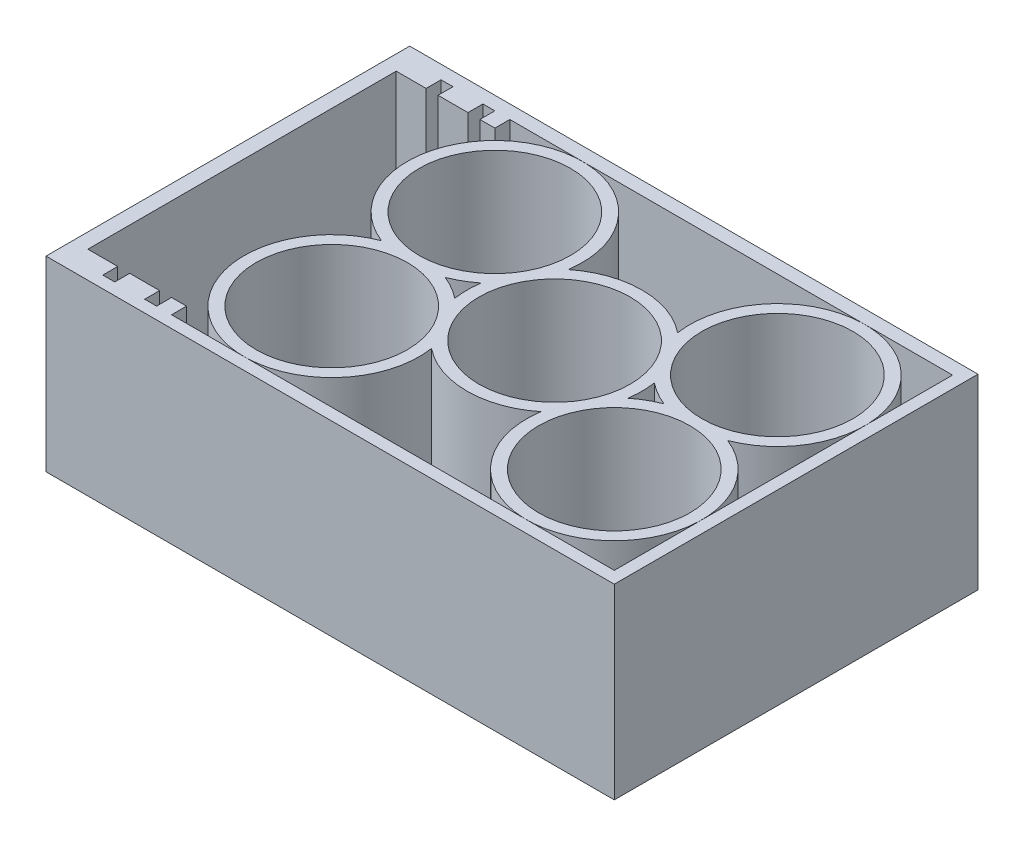
from build123d import *

# Parameters (mm, degrees)
SKETCH1_R             = 10.115000047
BOSS_EXTRUDE4_DEPTH   = 25
SKETCH1_W             = 76.040669035
SKETCH1_H             = 48.666950676
BOSS_EXTRUDE4_2_DEPTH = 25
SKETCH1_9_R           = 10.115000047
CUT_EXTRUDE1_DEPTH    = 36


with BuildPart() as part:
    # Sketch1 → Boss-Extrude4 (new body)
    with BuildSketch(Plane(origin=(0, 0, 0), x_dir=(1, 0, 0), z_dir=(0, 1, 0))):
        with BuildLine():
            ThreePointArc((22.33335059, 40.941406253), (13.444930876, 36.857737704), (10.753243591, 27.45373997))
            ThreePointArc((10.753243591, 27.45373997), (3.42801602, 30.026406253), (-3.897211552, 27.45373997))
            ThreePointArc((-3.897211552, 27.45373997), (-6.588898838, 36.857737705), (-15.477318554, 40.941406253))
            ThreePointArc((-15.477318554, 40.941406253), (-26.990581515, 31.391123299), (-19.732197967, 18.3114063))
            ThreePointArc((-19.732197967, 18.3114063), (-26.990581514, 5.231689296), (-15.477318545, -4.318593653))
            ThreePointArc((-15.477318545, -4.318593653), (-6.588898835, -0.234925102), (-3.897211552, 9.16907263))
            ThreePointArc((-3.897211552, 9.16907263), (3.42801602, 6.596406347), (10.753243591, 9.16907263))
            ThreePointArc((10.753243591, 9.16907263), (13.444930875, -0.234925102), (22.333350586, -4.318593653))
            ThreePointArc((22.333350586, -4.318593653), (30.617106493, -0.887349608), (34.048350537, 7.3964063))
            ThreePointArc((34.048350537, 7.3964063), (32.005142976, 14.006826546), (26.588230006, 18.3114063))
            ThreePointArc((26.588230006, 18.3114063), (32.005142976, 22.615986054), (34.048350537, 29.2264063))
            ThreePointArc((34.048350537, 29.2264063), (30.617106494, 37.510162206), (22.33335059, 40.941406253))
        make_face()
        with Locations((22.333350584, 29.2264063)):
            Circle(SKETCH1_R, mode=Mode.SUBTRACT)
        with BuildLine():
            ThreePointArc((15.008123013, 20.08407263), (16.475850608, 19.080918735), (18.078471162, 18.3114063))
            ThreePointArc((18.078471162, 18.3114063), (16.475850608, 17.541893865), (15.008123013, 16.53873997))
            ThreePointArc((15.008123013, 16.53873997), (15.143015973, 18.3114063), (15.008123013, 20.08407263))
        make_face(mode=Mode.SUBTRACT)
        with Locations((22.333350584, 7.3964063)):
            Circle(SKETCH1_R, mode=Mode.SUBTRACT)
        with BuildLine():
            ThreePointArc((-8.152090974, 16.53873997), (-9.619818569, 17.541893865), (-11.222439123, 18.3114063))
            ThreePointArc((-11.222439123, 18.3114063), (-9.619818569, 19.080918735), (-8.152090974, 20.08407263))
            ThreePointArc((-8.152090974, 20.08407263), (-8.286983933, 18.3114063), (-8.152090974, 16.53873997))
        make_face(mode=Mode.SUBTRACT)
        with Locations((-15.477318545, 7.3964063)):
            Circle(SKETCH1_R, mode=Mode.SUBTRACT)
    extrude(amount=BOSS_EXTRUDE4_DEPTH)

    # Sketch1<9> → Cut-Extrude1 (cut)
    with BuildSketch(Plane(origin=(0, 0, 0), x_dir=(1, 0, 0), z_dir=(0, 1, 0))):
        with Locations((3.42801602, 18.3114063)):
            Circle(SKETCH1_9_R)
        with Locations((-15.477318545, 29.2264063)):
            Circle(SKETCH1_9_R)
    extrude(amount=CUT_EXTRUDE1_DEPTH, mode=Mode.SUBTRACT)


with BuildPart() as body_2:
    # Sketch1 → Boss-Extrude4 2 (new body)
    with BuildSketch(Plane(origin=(0, 0, 0), x_dir=(1, 0, 0), z_dir=(0, 1, 0))):
        with Locations((-2.371983981, 18.414881685)):
            Rectangle(SKETCH1_W, SKETCH1_H)
        Polygon((-25.192318498, 38.941406253), (-25.192318498, 40.941406253), (-15.477318554, 40.941406253), (22.33335059, 40.941406253), (34.048350537, 40.941406253), (34.048350537, 29.2264063), (34.048350537, 7.3964063), (34.048350537, -4.318593653), (22.333350586, -4.318593653), (-15.477318545, -4.318593653), (-25.192318498, -4.318593653), (-25.192318498, -2.318593653), (-27.192318498, -2.318593653), (-27.192318498, -4.318593653), (-28.792318498, -4.318593653), (-28.792318498, -2.318593653), (-32.792318498, -2.318593653), (-32.792318498, -4.318593653), (-34.392318498, -4.318593653), (-34.392318498, -2.318593653), (-38.392318498, -2.318593653), (-38.392318498, 38.941406253), (-34.392318498, 38.941406253), (-34.392318498, 40.941406253), (-32.792318498, 40.941406253), (-32.792318498, 38.941406253), (-28.792318498, 38.941406253), (-28.792318498, 40.941406253), (-27.192318498, 40.941406253), (-27.192318498, 38.941406253), align=None, mode=Mode.SUBTRACT)
    extrude(amount=BOSS_EXTRUDE4_2_DEPTH)


solid = Compound([part.part, body_2.part])
